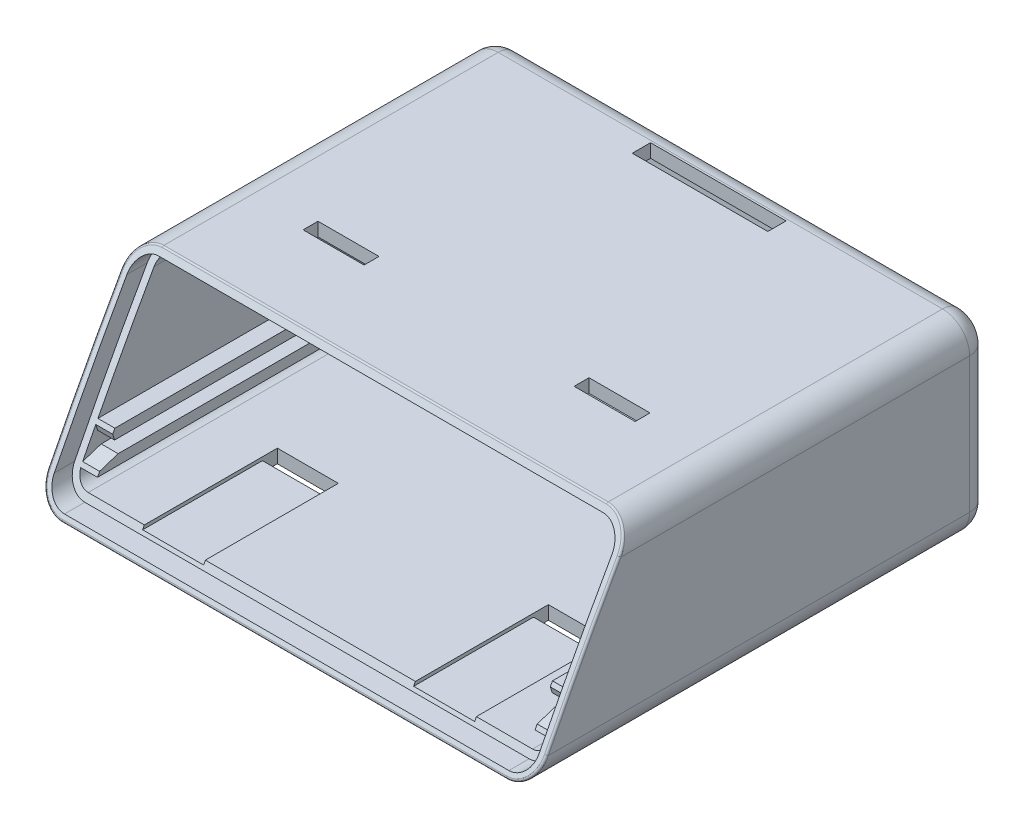
from build123d import *
from OCP.BRepAlgoAPI import BRepAlgoAPI_Cut
from OCP.TopTools import TopTools_ListOfShape

# Parameters (mm, degrees)
SKETCH1_W                = 73.58
SKETCH1_H                = 67.5
BOSS_EXTRUDE1_DEPTH      = 28
FILLET1_R                = 4
SHELL1_T                 = -2
CUT_EXTRUDE1_DEPTH       = 86.656750464
FILLET2_R                = 3
CUT_EXTRUDE3_REACH       = 162.173
CUT_EXTRUDE3_END_RADIUS  = 475
CUT_EXTRUDE3_START       = 80
FILLET3_R                = 0.3
BOSS_EXTRUDE2_REACH      = 82.024
BOSS_EXTRUDE2_END_RADIUS = 475
SKETCH5_W                = 2.5
SKETCH5_H                = 1.5
SKETCH6_W                = 14.3
SKETCH6_H                = 16.7
SKETCH6_W_2              = 11.05
SKETCH6_H_2              = 14.049996967
CUT_EXTRUDE4_DEPTH       = 2
SKETCH7_W                = 9
SKETCH7_H                = 2.2
CUT_EXTRUDE5_DEPTH       = 2
SKETCH11_W               = 9
SKETCH11_H               = 2.2
CUT_EXTRUDE8_DEPTH       = 2
SKETCH8_W                = 20
SKETCH8_H                = 2.4
CUT_EXTRUDE6_DEPTH       = 2
SKETCH9_W                = 9
SKETCH9_H                = 0.5
CUT_EXTRUDE7_DEPTH       = 66.275343836
SKETCH12_W               = 9
SKETCH12_H               = 0.5
CUT_EXTRUDE9_DEPTH       = 62.187502915
SKETCH10_W               = 13.75
SKETCH10_H               = 1.6
SKETCH10_W_2             = 27.64
SKETCH10_H_2             = 2
SKETCH10_W_3             = 2.84
BOSS_EXTRUDE3_DEPTH      = 0.5
CHAMFER1_START           = -34.79
CHAMFER1_DEPTH           = 69.58
SKETCH13_W               = 20
SKETCH13_H               = 2
CUT_EXTRUDE10_DEPTH      = 0.3


with BuildPart() as part:
    # Sketch1 → Boss-Extrude1 (new body)
    with BuildSketch(Plane(origin=(0, 0, 0), x_dir=(1, 0, 0), z_dir=(0, 1, 0))):
        Rectangle(SKETCH1_W, SKETCH1_H)
    extrude(amount=BOSS_EXTRUDE1_DEPTH)

    # Fillet1
    fillet1_edges = [part.edges().sort_by_distance(p)[0] for p in [
        (-36.79, 28, 0),
        (36.79, 28, 0),
        (-36.79, 0, 0),
        (36.79, 0, 0),
    ]]
    fillet(fillet1_edges, radius=FILLET1_R)

    # Shell1
    shell1_openings = [part.faces().sort_by_distance(p)[0] for p in [
        (0, 14, 33.75),
    ]]
    offset(amount=SHELL1_T, openings=shell1_openings, kind=Kind.INTERSECTION)


with BuildPart() as cut_extrude1_tool:
    # Sketch2 → Cut-Extrude1 (new, through all)
    with BuildSketch(Plane.ZY.offset(36.79)):
        with BuildLine():
            Line((18.75, 28), (33.75, 28))
            Line((33.75, 28), (33.75, 0))
            ThreePointArc((33.75, 0), (26.484121584, 14.125422277), (18.75, 28))
        make_face()
    extrude(amount=-CUT_EXTRUDE1_DEPTH)


with BuildPart() as part_1:
    add(part.part)

    # Cut-Extrude1: cut by cut_extrude1_tool, with a tolerance
    cut_extrude1_stock = TopTools_ListOfShape()
    cut_extrude1_stock.Append(part_1.part.wrapped)
    cut_extrude1_tools = TopTools_ListOfShape()
    cut_extrude1_tools.Append(cut_extrude1_tool.part.wrapped)
    cut_extrude1_cut = BRepAlgoAPI_Cut()
    cut_extrude1_cut.SetArguments(cut_extrude1_stock)
    cut_extrude1_cut.SetTools(cut_extrude1_tools)
    cut_extrude1_cut.SetFuzzyValue(0.00001)
    cut_extrude1_cut.Build()
    add(Compound.cast(cut_extrude1_cut.Shape()).solids(), mode=Mode.REPLACE)

    # Fillet2
    fillet2_edges = [part_1.edges().sort_by_distance(p)[0] for p in [
        (0, 28, -33.75),
        (0, 0, -33.75),
        (-36.79, 14, -33.75),
        (36.79, 14, -33.75),
        (-35.618427125, 26.828427125, -33.75),
        (-35.618427125, 1.171572875, -33.75),
        (35.618427125, 1.171572875, -33.75),
        (35.618427125, 26.828427125, -33.75),
    ]]
    fillet(fillet2_edges, radius=FILLET2_R)

    # Cut-Extrude3: up to this cylinder (the profile starts outside it)
    cut_extrude3_end = Plane(origin=(0, -210.179748667, -395.218864179), z_dir=(-1, 0, 0)) * Cylinder(CUT_EXTRUDE3_END_RADIUS, 1275.346, mode=Mode.PRIVATE)
    # Sketch4 → Cut-Extrude3 (cut, up to the surface)
    with BuildSketch(Plane.XY.offset(-31.75).offset(CUT_EXTRUDE3_START), mode=Mode.PRIVATE) as cut_extrude3_sk1:
        with BuildLine():
            Line((32.79, 27), (-32.79, 27))
            ThreePointArc((-32.79, 27), (-34.911320344, 26.121320344), (-35.79, 24))
            Line((-35.79, 24), (-35.79, 4))
            ThreePointArc((-35.79, 4), (-34.911320344, 1.878679656), (-32.79, 1))
            Line((-32.79, 1), (32.79, 1))
            ThreePointArc((32.79, 1), (34.911320344, 1.878679656), (35.79, 4))
            Line((35.79, 4), (35.79, 24))
            ThreePointArc((35.79, 24), (34.911320344, 26.121320344), (32.79, 27))
        make_face()
        with BuildLine():
            Line((32.79, 26), (-32.79, 26))
            ThreePointArc((-32.79, 26), (-34.204213562, 25.414213562), (-34.79, 24))
            Line((-34.79, 24), (-34.79, 4))
            ThreePointArc((-34.79, 4), (-34.204213562, 2.585786438), (-32.79, 2))
            Line((-32.79, 2), (32.79, 2))
            ThreePointArc((32.79, 2), (34.204213562, 2.585786438), (34.79, 4))
            Line((34.79, 4), (34.79, 24))
            ThreePointArc((34.79, 24), (34.204213562, 25.414213562), (32.79, 26))
        make_face(mode=Mode.SUBTRACT)
    cut_extrude3_tool1 = extrude(cut_extrude3_sk1.sketch, amount=-CUT_EXTRUDE3_REACH, mode=Mode.PRIVATE) - cut_extrude3_end
    add(cut_extrude3_tool1.solids().sort_by_distance((0, 26.238443, 48.25))[0], mode=Mode.SUBTRACT)

    # Fillet3
    fillet3_edges = [part_1.edges().sort_by_distance(p)[0] for p in [
        (0, 0, 33.75),
        (-36.79, 14.0639546, 26.517044891),
        (35.714985447, 26.728453829, 19.484309952),
        (35.696759777, 1.252137621, 33.12988385),
        (-35.696759776, 1.252137622, 33.12988385),
        (-35.714985447, 26.728453829, 19.484309952),
        (36.79, 14.0639546, 26.517044891),
        (0, 28, 18.75),
    ]]
    fillet(fillet3_edges, radius=FILLET3_R)

    # Boss-Extrude2: up to this cylinder (the profile starts inside it)
    boss_extrude2_end = Plane(origin=(0, -210.179748667, -395.218864179), z_dir=(-1, 0, 0)) * Cylinder(BOSS_EXTRUDE2_END_RADIUS, 1182.128, mode=Mode.PRIVATE)
    # Sketch5 → Boss-Extrude2 (add, up to the surface)
    with BuildSketch(Plane.XY.offset(-31.75), mode=Mode.PRIVATE) as boss_extrude2_sk1:
        with Locations((33.54, 4.5)):
            Rectangle(SKETCH5_W, SKETCH5_H)
    boss_extrude2_tool1 = extrude(boss_extrude2_sk1.sketch, amount=BOSS_EXTRUDE2_REACH, mode=Mode.PRIVATE) & boss_extrude2_end
    add(boss_extrude2_tool1.solids().sort_by_distance((33.54, 4.5, -31.75))[0])
    # Sketch5 → Boss-Extrude2 (add, up to the surface)
    with BuildSketch(Plane.XY.offset(-31.75), mode=Mode.PRIVATE) as boss_extrude2_sk2:
        with Locations((33.54, 8)):
            Rectangle(SKETCH5_W, SKETCH5_H)
    boss_extrude2_tool2 = extrude(boss_extrude2_sk2.sketch, amount=BOSS_EXTRUDE2_REACH, mode=Mode.PRIVATE) & boss_extrude2_end
    add(boss_extrude2_tool2.solids().sort_by_distance((33.54, 8, -31.75))[0])
    # Sketch5 → Boss-Extrude2 (add, up to the surface)
    with BuildSketch(Plane.XY.offset(-31.75), mode=Mode.PRIVATE) as boss_extrude2_sk3:
        with Locations((-33.54, 8)):
            Rectangle(SKETCH5_W, SKETCH5_H)
    boss_extrude2_tool3 = extrude(boss_extrude2_sk3.sketch, amount=BOSS_EXTRUDE2_REACH, mode=Mode.PRIVATE) & boss_extrude2_end
    add(boss_extrude2_tool3.solids().sort_by_distance((-33.54, 8, -31.75))[0])
    # Sketch5 → Boss-Extrude2 (add, up to the surface)
    with BuildSketch(Plane.XY.offset(-31.75), mode=Mode.PRIVATE) as boss_extrude2_sk4:
        with Locations((-33.54, 4.5)):
            Rectangle(SKETCH5_W, SKETCH5_H)
    boss_extrude2_tool4 = extrude(boss_extrude2_sk4.sketch, amount=BOSS_EXTRUDE2_REACH, mode=Mode.PRIVATE) & boss_extrude2_end
    add(boss_extrude2_tool4.solids().sort_by_distance((-33.54, 4.5, -31.75))[0])

    # Sketch6 → Cut-Extrude4 (cut)
    with BuildSketch(Plane(origin=(0, 0, -33.75), x_dir=(-1, 0, 0), z_dir=(0, 0, -1))):
        with Locations((0, 10.35)):
            Rectangle(SKETCH6_W, SKETCH6_H)
        with Locations((26.425, 10.175001517)):
            Rectangle(SKETCH6_W_2, SKETCH6_H_2)
    extrude(amount=-CUT_EXTRUDE4_DEPTH, mode=Mode.SUBTRACT)

    # Sketch7 → Cut-Extrude5 (cut)
    with BuildSketch(Plane(origin=(0, 28, 0), x_dir=(1, 0, 0), z_dir=(0, 1, 0))):
        with Locations((-20, -5.23)):
            Rectangle(SKETCH7_W, SKETCH7_H)
        with Locations((20, -5.23)):
            Rectangle(SKETCH7_W, SKETCH7_H)
    extrude(amount=-CUT_EXTRUDE5_DEPTH, mode=Mode.SUBTRACT)

    # Sketch11 → Cut-Extrude8 (cut)
    with BuildSketch(Plane.XZ):
        with Locations((-20, 11.23)):
            Rectangle(SKETCH11_W, SKETCH11_H)
        with Locations((20, 11.23)):
            Rectangle(SKETCH11_W, SKETCH11_H)
    extrude(amount=-CUT_EXTRUDE8_DEPTH, mode=Mode.SUBTRACT)

    # Sketch8 → Cut-Extrude6 (cut)
    with BuildSketch(Plane(origin=(0, 28, 0), x_dir=(1, 0, 0), z_dir=(0, 1, 0))):
        with Locations((0, 28.95)):
            Rectangle(SKETCH8_W, SKETCH8_H)
    extrude(amount=-CUT_EXTRUDE6_DEPTH, mode=Mode.SUBTRACT)

    # Sketch9 → Cut-Extrude7 (cut, through all)
    with BuildSketch(Plane(origin=(0, 0, 12.33), x_dir=(-1, 0, 0), z_dir=(0, 0, -1))):
        with Locations((20, 1.75)):
            Rectangle(SKETCH9_W, SKETCH9_H)
        with Locations((-20, 1.75)):
            Rectangle(SKETCH9_W, SKETCH9_H)
    extrude(amount=-CUT_EXTRUDE7_DEPTH, mode=Mode.SUBTRACT)

    # Sketch12 → Cut-Extrude9 (cut, through all)
    with BuildSketch(Plane(origin=(0, 0, 6.33), x_dir=(-1, 0, 0), z_dir=(0, 0, -1))):
        with Locations((20, 26.25)):
            Rectangle(SKETCH12_W, SKETCH12_H)
        with Locations((-20, 26.25)):
            Rectangle(SKETCH12_W, SKETCH12_H)
    extrude(amount=-CUT_EXTRUDE9_DEPTH, mode=Mode.SUBTRACT)

    # Sketch10 → Boss-Extrude3 (add)
    with BuildSketch(Plane.XY.offset(-31.75)):
        with Locations((-14.025, 6.25)):
            Rectangle(SKETCH10_W, SKETCH10_H)
        with Locations((20.97, 6.25)):
            Rectangle(SKETCH10_W_2, SKETCH10_H_2)
        with Locations((-33.37, 6.25)):
            Rectangle(SKETCH10_W_3, SKETCH10_H_2)
    extrude(amount=BOSS_EXTRUDE3_DEPTH)

    # Chamfer1: read off the stored shape, not the designer's step
    # Chamfer1 outline → Chamfer1 (cut)
    with BuildSketch(Plane.YZ.offset(CHAMFER1_START)):
        with BuildLine():
            ThreePointArc((8.137667838, 26.63716061), (7.693954372, 26.866493923), (7.25, 27.095360533))
            Line((7.25, 27.095360533), (7.25, 26.352876009))
            Line((7.25, 26.352876009), (8.137667838, 26.63716061))
        make_face()
        with BuildLine():
            Line((4.359221973, 28.571213662), (5.25, 25.834427816))
            Line((5.25, 25.834427816), (5.25, 28.11908993))
            ThreePointArc((5.25, 28.11908993), (4.804729842, 28.345385965), (4.359221973, 28.571213662))
        make_face()
    extrude(amount=CHAMFER1_DEPTH, mode=Mode.SUBTRACT)

    # Sketch13 → Cut-Extrude10 (cut)
    with BuildSketch(Plane.XY.offset(-30.15)):
        with Locations((0, 27)):
            Rectangle(SKETCH13_W, SKETCH13_H)
    extrude(amount=-CUT_EXTRUDE10_DEPTH, mode=Mode.SUBTRACT)


solid = part_1.part
